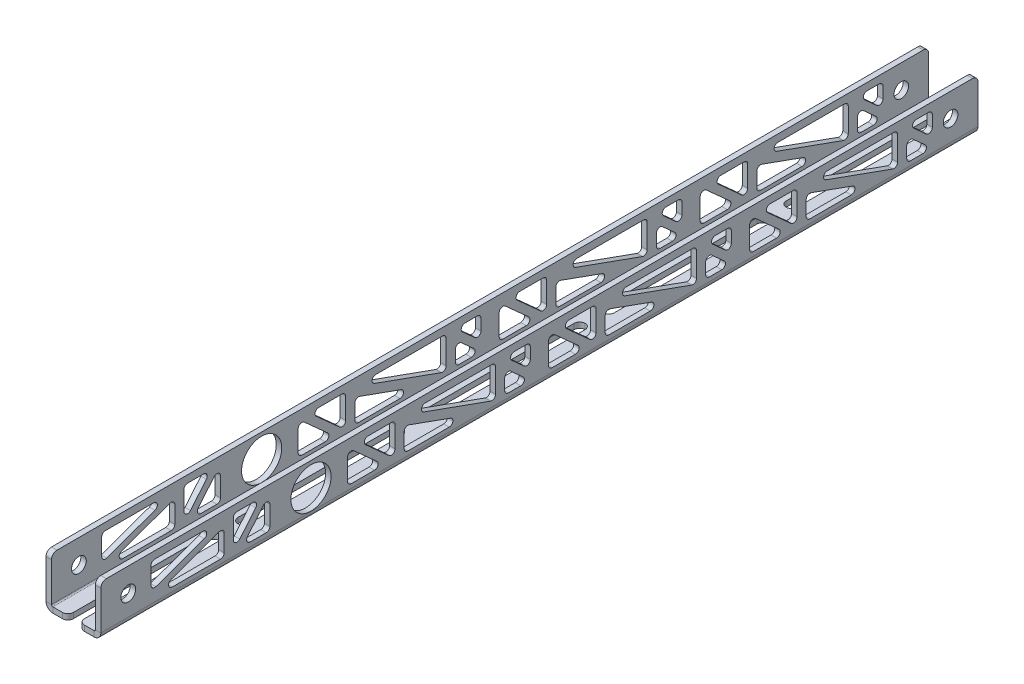
from build123d import *

# Parameters (mm, degrees)
SKETCH1_W                      = 30
SKETCH1_H                      = 480
BASE_FLANGE1_DEPTH             = 3
EDGE_FLANGE1_STRIP_W           = 13.4732
EDGE_FLANGE1_STRIP_H           = 3
EDGE_FLANGE1_STRIP_CUT_DEPTH   = 480
EDGE_FLANGE1_STRIP_2_W         = 13.4732
EDGE_FLANGE1_STRIP_2_H         = 3
EDGE_FLANGE1_STRIP_CUT_2_DEPTH = 480
EDGE_FLANGE1_DEPTH             = 480
EDGE_FLANGE1_BEND_DEPTH        = 480
SKETCH12_W                     = 6
SKETCH12_H                     = 90
CUT_EXTRUDE1_DEPTH             = 242.764348075
LPATTERN1_COUNT                = 5
LPATTERN1_PITCH                = 100
CUT_EXTRUDE2_DEPTH             = 242.764348075
CUT_EXTRUDE2_DEPTH_BACK        = 242.764348075
SKETCH14_R                     = 11
SKETCH14_R_2                   = 4
SKETCH14_R_3                   = 4.05
FILLET1_R                      = 3
CUT_EXTRUDE3_DEPTH             = 242.764348075
LPATTERN2_COUNT                = 3
LPATTERN2_PITCH                = 110
CUT_EXTRUDE4_DEPTH             = 242.764348075
CUT_EXTRUDE4_DEPTH_BACK        = 242.764348075
FILLET2_R                      = 2


# Sheet-metal steps are written as plain solids
with BuildPart() as part:
    # Sketch1 → Base-Flange1 (new body)
    with BuildSketch(Plane(origin=(0, 0, 0), x_dir=(1, 0, 0), z_dir=(0, 1, 0))):
        Rectangle(SKETCH1_W, SKETCH1_H)
    extrude(amount=-BASE_FLANGE1_DEPTH)

    # Edge-Flange1 strip (across the edge) → Edge-Flange1 strip cut (cut)
    with BuildSketch(Plane(origin=(-15, 0, -240), x_dir=(1, 0, 0), z_dir=(0, 0, 1))):
        with Locations((-3, -1.5)):
            Rectangle(EDGE_FLANGE1_STRIP_W, EDGE_FLANGE1_STRIP_H)
    extrude(amount=EDGE_FLANGE1_STRIP_CUT_DEPTH, mode=Mode.SUBTRACT)

    # Edge-Flange1 strip 2 (across the edge) → Edge-Flange1 strip cut 2 (cut)
    with BuildSketch(Plane(origin=(15, 0, 240), x_dir=(-1, 0, 0), z_dir=(0, 0, -1))):
        with Locations((-3, -1.5)):
            Rectangle(EDGE_FLANGE1_STRIP_2_W, EDGE_FLANGE1_STRIP_2_H)
    extrude(amount=EDGE_FLANGE1_STRIP_CUT_2_DEPTH, mode=Mode.SUBTRACT)

    # Edge-Flange1 section (across the edge) → Edge-Flange1 (add)
    with BuildSketch(Plane(origin=(-15, 0, -240), x_dir=(1, 0, 0), z_dir=(0, 0, 1))):
        with BuildLine():
            Line((0, 0.7366), (0, 25))
            Line((0, 25), (3, 25))
            Line((3, 25), (3, 0.7366))
            ThreePointArc((3, 0.7366), (3.215745145, 0.215745145), (3.7366, 0))
            Line((3.7366, 0), (3.7366, -3))
            ThreePointArc((3.7366, -3), (1.094424801, -1.905575199), (0, 0.7366))
        make_face()
    extrude(amount=EDGE_FLANGE1_DEPTH)

    # Edge-Flange1 section 2 (across the edge) → Edge-Flange1 bend (add)
    with BuildSketch(Plane(origin=(15, 0, 240), x_dir=(-1, 0, 0), z_dir=(0, 0, -1))):
        with BuildLine():
            Line((0, 0.7366), (0, 25))
            Line((0, 25), (3, 25))
            Line((3, 25), (3, 0.7366))
            ThreePointArc((3, 0.7366), (3.215745145, 0.215745145), (3.7366, 0))
            Line((3.7366, 0), (3.7366, -3))
            ThreePointArc((3.7366, -3), (1.094424801, -1.905575199), (0, 0.7366))
        make_face()
    extrude(amount=EDGE_FLANGE1_BEND_DEPTH)

    # Sketch12 → Cut-Extrude1 (cut, symmetric)
    with BuildSketch(Plane(origin=(0, 0, 0), x_dir=(1, 0, 0), z_dir=(0, 1, 0))):
        with Locations((0, 195)):
            Rectangle(SKETCH12_W, SKETCH12_H)
    cut_extrude1 = extrude(amount=CUT_EXTRUDE1_DEPTH, both=True, mode=Mode.SUBTRACT)

    # LPattern1: Cut-Extrude1 ×5
    with Locations(*[(0, 0, i * LPATTERN1_PITCH) for i in range(1, LPATTERN1_COUNT)]):
        add(cut_extrude1, mode=Mode.SUBTRACT)

    # Sketch14 → Cut-Extrude2 (cut, two sides: drawn at the far end of the back side and taken through both)
    with BuildSketch(Plane(origin=(0, 0, 0), x_dir=(0, 0, -1), z_dir=(1, 0, 0)).offset(-CUT_EXTRUDE2_DEPTH_BACK)):
        with Locations((-125, 12)):
            Circle(SKETCH14_R)
        with Locations((225, 12)):
            Circle(SKETCH14_R_2)
        with Locations((-225, 12)):
            Circle(SKETCH14_R_3)
    extrude(amount=CUT_EXTRUDE2_DEPTH + CUT_EXTRUDE2_DEPTH_BACK, mode=Mode.SUBTRACT)

    # Fillet1
    fillet1_edges = [part.edges().sort_by_distance(p)[0] for p in [
        (-13.5, 25, 240),
        (-3, -1.5, 60),
        (3, -1.5, 60),
        (13.5, 25, 240),
        (13.5, 25, -240),
        (3, -1.5, -240),
        (3, -1.5, -150),
        (-3, -1.5, -150),
        (-3, -1.5, -240),
        (-13.5, 25, -240),
        (3, -1.5, 50),
        (-3, -1.5, 50),
        (-3, -1.5, -40),
        (3, -1.5, -50),
        (-3, -1.5, -50),
        (3, -1.5, -40),
        (3, -1.5, -140),
        (-3, -1.5, -140),
        (-3, -1.5, 160),
        (-3, -1.5, 240),
        (3, -1.5, 240),
        (3, -1.5, 160),
        (3, -1.5, 150),
        (-3, -1.5, 150),
    ]]
    fillet(fillet1_edges, radius=FILLET1_R - 0.0001)  # a hair under: the kernel refuses the full size

    # Sketch15 → Cut-Extrude3 (cut, symmetric)
    with BuildSketch(Plane(origin=(0, 0, 0), x_dir=(0, 0, -1), z_dir=(1, 0, 0))):
        Polygon((-105, 21), (-105, 3), (-85, 3), align=None)
        Polygon((-99, 21), (-79, 3), (-79, 21), align=None)
        Polygon((-74, 21), (-24, 3), (-24, 21), align=None)
        Polygon((-74, 3), (-74, 16), (-37.888888889, 3), align=None)
        Polygon((-19, 21), (-5, 8.384427122), (-5, 21), align=None)
        Polygon((-19, 3), (-5, 3), (-19, 15.615572878), align=None)
    cut_extrude3 = extrude(amount=CUT_EXTRUDE3_DEPTH, both=True, mode=Mode.SUBTRACT)

    # LPattern2: Cut-Extrude3 ×3
    with Locations(*[(0, 0, -i * LPATTERN2_PITCH) for i in range(1, LPATTERN2_COUNT)]):
        add(cut_extrude3, mode=Mode.SUBTRACT)

    # Sketch16 → Cut-Extrude4 (cut, two sides: drawn at the far end of the back side and taken through both)
    with BuildSketch(Plane(origin=(0, 0, 0), x_dir=(0, 0, -1), z_dir=(1, 0, 0)).offset(-CUT_EXTRUDE4_DEPTH_BACK)):
        Polygon((-212.5, 3), (-172.5, 3), (-172.5, 17.283546603), align=None)
        Polygon((-212.5, 21), (-172.5, 21), (-212.5, 6.716453397), align=None)
        Polygon((-167.5, 21), (-152.5, 21), (-167.5, 3), align=None)
        Polygon((-162.5, 3), (-147.5, 21), (-147.5, 3), align=None)
    extrude(amount=CUT_EXTRUDE4_DEPTH + CUT_EXTRUDE4_DEPTH_BACK, mode=Mode.SUBTRACT)

    # Fillet2
    fillet2_edges = [part.edges().sort_by_distance(p)[0] for p in [
        (13.5, 3, 19),
        (13.5, 15.615572878, 19),
        (13.5, 3, 5),
        (-13.5, 3, 19),
        (-13.5, 15.615572878, 19),
        (-13.5, 3, 5),
        (13.5, 21, 74),
        (13.5, 21, 24),
        (13.5, 3, 24),
        (-13.5, 21, 74),
        (-13.5, 21, 24),
        (-13.5, 3, 24),
        (13.5, 3, 37.888888889),
        (13.5, 3, 74),
        (13.5, 16, 74),
        (-13.5, 3, 37.888888889),
        (-13.5, 3, 74),
        (-13.5, 16, 74),
        (13.5, 3, 85),
        (13.5, 3, 105),
        (13.5, 21, 105),
        (-13.5, 3, 85),
        (-13.5, 3, 105),
        (-13.5, 21, 105),
        (13.5, 21, 99),
        (13.5, 21, 79),
        (13.5, 3, 79),
        (-13.5, 21, 99),
        (-13.5, 21, 79),
        (-13.5, 3, 79),
        (13.5, 21, 19),
        (13.5, 21, 5),
        (13.5, 8.384427122, 5),
        (-13.5, 21, 19),
        (-13.5, 21, 5),
        (-13.5, 8.384427122, 5),
        (-13.5, 3, -91),
        (-13.5, 15.615572878, -91),
        (-13.5, 3, -105),
        (-13.5, 3, -201),
        (-13.5, 15.615572878, -201),
        (-13.5, 3, -215),
        (13.5, 8.384427122, -105),
        (13.5, 21, -105),
        (13.5, 21, -91),
        (13.5, 8.384427122, -215),
        (13.5, 21, -215),
        (13.5, 21, -201),
        (13.5, 3, -31),
        (13.5, 21, -31),
        (13.5, 21, -11),
        (13.5, 3, -141),
        (13.5, 21, -141),
        (13.5, 21, -121),
        (13.5, 21, -5),
        (13.5, 3, -5),
        (13.5, 3, -25),
        (13.5, 21, -115),
        (13.5, 3, -115),
        (13.5, 3, -135),
        (13.5, 16, -36),
        (13.5, 3, -36),
        (13.5, 3, -72.111111111),
        (13.5, 16, -146),
        (13.5, 3, -146),
        (13.5, 3, -182.111111111),
        (13.5, 3, -86),
        (13.5, 21, -86),
        (13.5, 21, -36),
        (13.5, 3, -196),
        (13.5, 21, -196),
        (13.5, 21, -146),
        (13.5, 3, -105),
        (13.5, 15.615572878, -91),
        (13.5, 3, -91),
        (13.5, 3, -215),
        (13.5, 15.615572878, -201),
        (13.5, 3, -201),
        (-13.5, 21, -91),
        (-13.5, 21, -105),
        (-13.5, 8.384427122, -105),
        (-13.5, 21, -201),
        (-13.5, 21, -215),
        (-13.5, 8.384427122, -215),
        (-13.5, 21, -11),
        (-13.5, 21, -31),
        (-13.5, 3, -31),
        (-13.5, 21, -121),
        (-13.5, 21, -141),
        (-13.5, 3, -141),
        (-13.5, 3, -25),
        (-13.5, 3, -5),
        (-13.5, 21, -5),
        (-13.5, 3, -135),
        (-13.5, 3, -115),
        (-13.5, 21, -115),
        (-13.5, 3, -72.111111111),
        (-13.5, 3, -36),
        (-13.5, 16, -36),
        (-13.5, 3, -182.111111111),
        (-13.5, 3, -146),
        (-13.5, 16, -146),
        (-13.5, 21, -36),
        (-13.5, 21, -86),
        (-13.5, 3, -86),
        (-13.5, 21, -146),
        (-13.5, 21, -196),
        (-13.5, 3, -196),
        (13.5, 3, 167.5),
        (13.5, 21, 167.5),
        (13.5, 21, 152.5),
        (-13.5, 3, 167.5),
        (-13.5, 21, 167.5),
        (-13.5, 21, 152.5),
        (13.5, 21, 172.5),
        (13.5, 6.716453397, 212.5),
        (13.5, 21, 212.5),
        (-13.5, 21, 172.5),
        (-13.5, 6.716453397, 212.5),
        (-13.5, 21, 212.5),
        (13.5, 3, 212.5),
        (13.5, 17.283546603, 172.5),
        (13.5, 3, 172.5),
        (-13.5, 3, 212.5),
        (-13.5, 17.283546603, 172.5),
        (-13.5, 3, 172.5),
        (13.5, 21, 147.5),
        (13.5, 3, 147.5),
        (13.5, 3, 162.5),
        (-13.5, 21, 147.5),
        (-13.5, 3, 147.5),
        (-13.5, 3, 162.5),
    ]]
    fillet(fillet2_edges, radius=FILLET2_R)


solid = part.part
